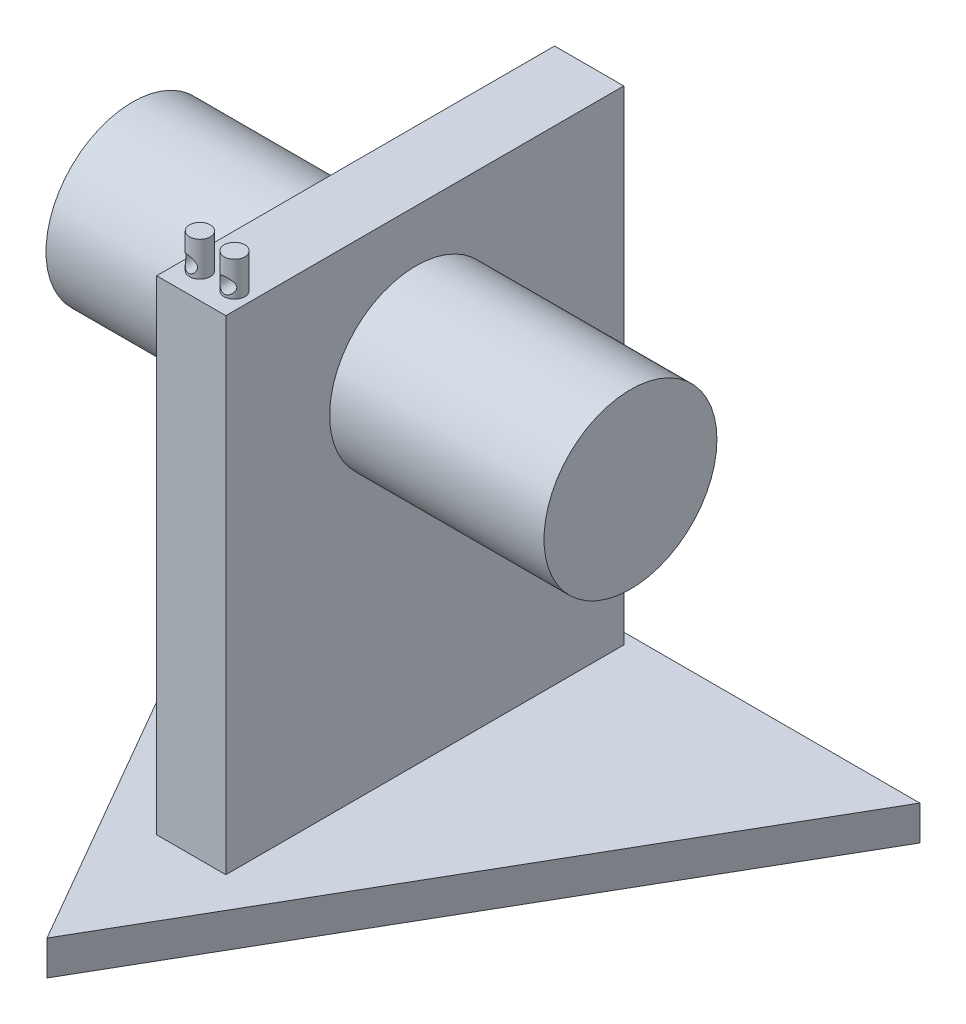
from build123d import *

# Parameters (mm, degrees)
BOSS_EXTRUDE1_DEPTH    = 10
SKETCH6_W              = 20
SKETCH6_H              = 64.955790415
SKETCH6_H_2            = 50.098640903
BOSS_EXTRUDE4_DEPTH    = 140
SKETCH7_R              = 25
BOSS_EXTRUDE5_DEPTH    = 62
SKETCH12_R             = 3
BOSS_EXTRUDE6_DEPTH    = 10
CUT_EXTRUDE1_START     = 54.455790306
CUT_EXTRUDE1_OUTLINE_R = 2.25
CUT_EXTRUDE1_DEPTH     = 6.544209694


with BuildPart() as part:
    # Sketch1 → Boss-Extrude1 (new body)
    with BuildSketch(Plane(origin=(0, 0, 0), x_dir=(1, 0, 0), z_dir=(0, 1, 0))):
        Polygon((0, -106.666666667), (92.37604307, 53.333333333), (-92.37604307, 53.333333333), align=None)
    extrude(amount=BOSS_EXTRUDE1_DEPTH)

    # Sketch6 → Boss-Extrude4 (add)
    with BuildSketch(Plane(origin=(0, 10, 0), x_dir=(1, 0, 0), z_dir=(0, 1, 0))):
        with Locations((0, -32.477895208)):
            Rectangle(SKETCH6_W, SKETCH6_H)
        with Locations((0, 25.049320452)):
            Rectangle(SKETCH6_W, SKETCH6_H_2)
    extrude(amount=BOSS_EXTRUDE4_DEPTH)

    # Sketch7 → Boss-Extrude5 (add)
    with BuildSketch(Plane(origin=(10, 0, 0), x_dir=(0, 0, -1), z_dir=(1, 0, 0))):
        with Locations((-9.955790415, 110)):
            Circle(SKETCH7_R)
    boss_extrude5 = extrude(amount=BOSS_EXTRUDE5_DEPTH)

    # Mirror1: Boss-Extrude5 across plane
    add(boss_extrude5.mirror(Plane(origin=(0, 0, 0), x_dir=(0, 0, 1), z_dir=(1, 0, 0))))

    # Sketch12 → Boss-Extrude6 (add)
    with BuildSketch(Plane(origin=(0, 150, 0), x_dir=(1, 0, 0), z_dir=(0, 1, 0))):
        with Locations(Location((5, -57.455790415, 0), (0, 0, 270))):
            Circle(SKETCH12_R)
        with Locations(Location((-5, -57.455790415, 0), (0, 0, 270))):
            Circle(SKETCH12_R)
    extrude(amount=BOSS_EXTRUDE6_DEPTH)

    # Cut-Extrude1: read off the stored shape, not the designer's step
    # Cut-Extrude1 outline → Cut-Extrude1 (cut)
    with BuildSketch(Plane.XY.offset(CUT_EXTRUDE1_START)):
        with Locations((-5.5, 152.935681358)):
            Circle(CUT_EXTRUDE1_OUTLINE_R)
        with Locations((5.176294741, 152.935681358)):
            Circle(CUT_EXTRUDE1_OUTLINE_R)
    extrude(amount=CUT_EXTRUDE1_DEPTH, mode=Mode.SUBTRACT)


solid = part.part
